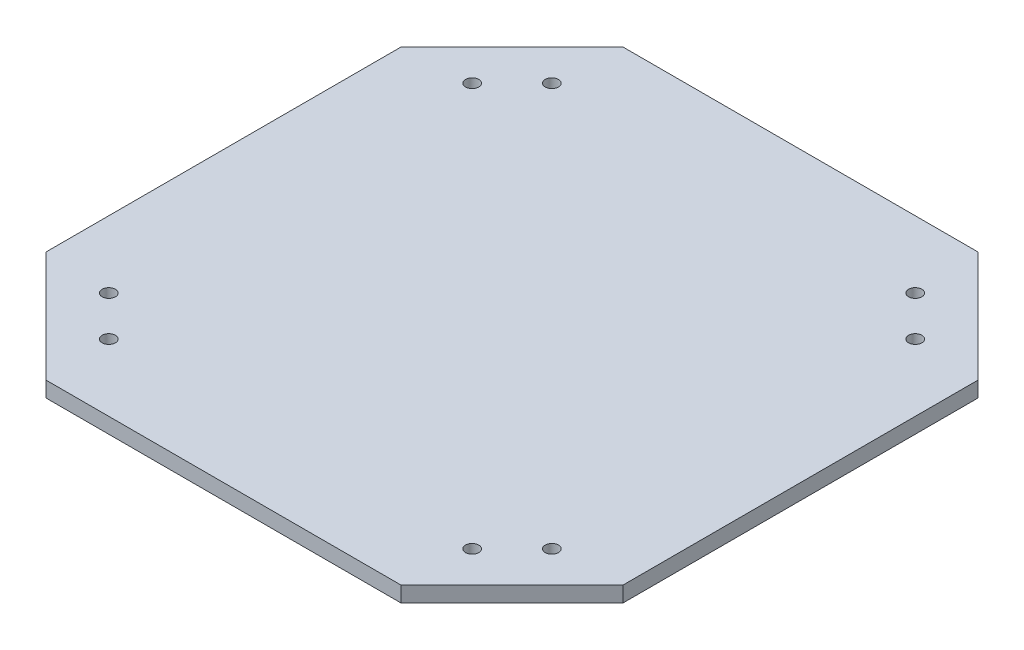
from build123d import *

# Parameters (mm, degrees)
SKETCH2_R           = 1.49
BOSS_EXTRUDE1_DEPTH = 3.5


with BuildPart() as part:
    # Sketch2 → Boss-Extrude1 (new body)
    with BuildSketch(Plane(origin=(0, 0, 0), x_dir=(1, 0, 0), z_dir=(0, 1, 0))):
        Polygon((-65, 40), (-40, 65), (40, 65), (65, 40), (65, -40), (40, -65), (-40, -65), (-65, -40), align=None)
        with Locations((40.938804128, -49.919060249)):
            Circle(SKETCH2_R, mode=Mode.SUBTRACT)
        with Locations((49.919060249, -40.938804128)):
            Circle(SKETCH2_R, mode=Mode.SUBTRACT)
        with Locations((-40.938804128, 49.919060249)):
            Circle(SKETCH2_R, mode=Mode.SUBTRACT)
        with Locations((-49.919060249, 40.938804128)):
            Circle(SKETCH2_R, mode=Mode.SUBTRACT)
        with Locations((-40.938804128, -49.919060249)):
            Circle(SKETCH2_R, mode=Mode.SUBTRACT)
        with Locations((-49.919060249, -40.938804128)):
            Circle(SKETCH2_R, mode=Mode.SUBTRACT)
        with Locations((49.919060249, 40.938804128)):
            Circle(SKETCH2_R, mode=Mode.SUBTRACT)
        with Locations((40.938804128, 49.919060249)):
            Circle(SKETCH2_R, mode=Mode.SUBTRACT)
    extrude(amount=BOSS_EXTRUDE1_DEPTH)


solid = part.part
